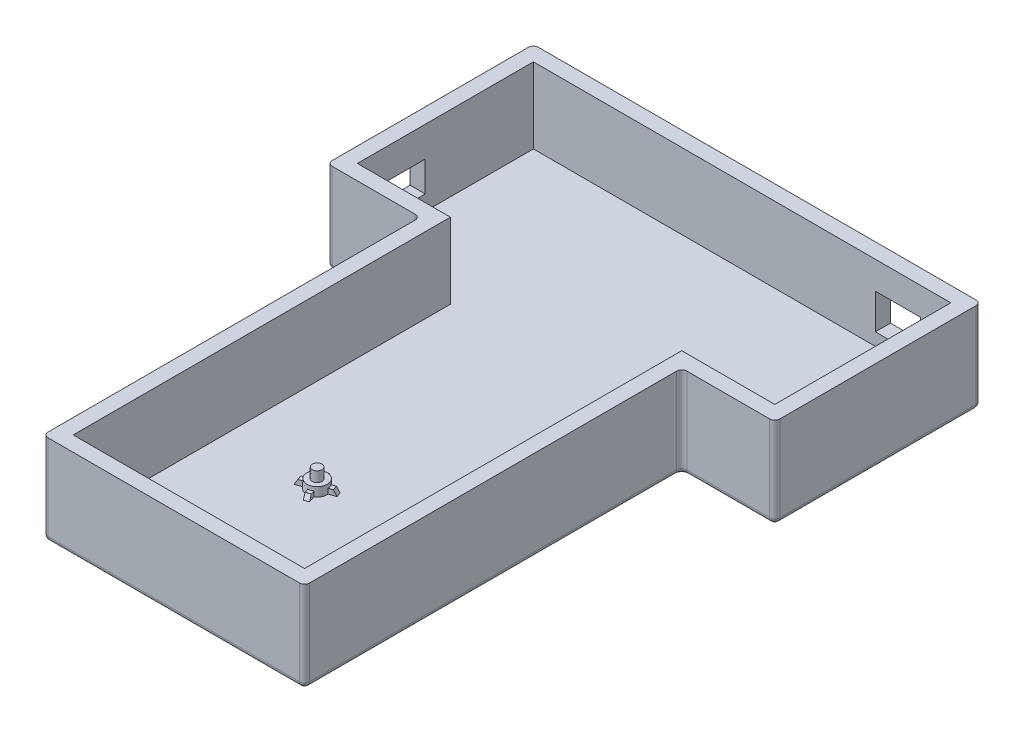
from build123d import *

# Parameters (mm, degrees)
BOSS_EXTRUDE1_DEPTH = 15
SHELL1_T            = 3
SKETCH2_W           = 10.2
SKETCH2_H           = 6
CUT_EXTRUDE1_DEPTH  = 4
SKETCH3_W           = 9
SKETCH3_H           = 7
CUT_EXTRUDE2_DEPTH  = 4
FILLET1_R           = 1


with BuildPart() as part:
    # Sketch1 → Boss-Extrude1 (new body)
    with BuildSketch(Plane(origin=(0, 0, 0), x_dir=(1, 0, 0), z_dir=(0, 1, 0))):
        Polygon((64.5, 0), (18.5, 0), (18.5, 75), (0, 75), (0, 110), (83, 110), (83, 75), (64.5, 75), align=None)
    extrude(amount=BOSS_EXTRUDE1_DEPTH)

    # Shell1
    shell1_openings = [part.faces().sort_by_distance(p)[0] for p in [
        (41.5, 15, -62.641620771),
    ]]
    offset(amount=SHELL1_T, openings=shell1_openings, kind=Kind.INTERSECTION)

    # Sketch2 → Cut-Extrude1 (cut)
    with BuildSketch(Plane.ZY.offset(3)):
        with Locations((-83.4, 6)):
            Rectangle(SKETCH2_W, SKETCH2_H)
    extrude(amount=-CUT_EXTRUDE1_DEPTH, mode=Mode.SUBTRACT)

    # Sketch3 → Cut-Extrude2 (cut)
    with BuildSketch(Plane(origin=(0, 0, -113), x_dir=(-1, 0, 0), z_dir=(0, 0, -1))):
        with Locations((-72.5, 6)):
            Rectangle(SKETCH3_W, SKETCH3_H)
    extrude(amount=-CUT_EXTRUDE2_DEPTH, mode=Mode.SUBTRACT)

    # Mounting Boss1: read off the stored shape, not the designer's step
    # Mounting Boss1 outline → Mounting Boss1 (revolve)
    with BuildSketch(Plane(origin=(37, 0, -30), x_dir=(1, 0, 0), z_dir=(0, 0, 1))):
        Polygon((2, 1.746), (1, 1.746), (0.96508987, 3.746), (0, 3.746), (0, 0), (2.060971664, 0), align=None)
    revolve(axis=Axis((37, 0, -30), (0, 1, 0)))

    # Mounting Boss1 2: loft between two sections, ruled curve by curve
    mounting_boss1_2_from = [
        Edge.make_line((36.406329718, 0, -33.362149675), (36.84207555, 0, -32.05491218)),
        Edge.make_line((35.893392252, 0, -31.738684414), (35.45764642, 0, -33.045921909)),
        Edge.make_line((36.406329718, 0, -33.362149675), (35.45764642, 0, -33.045921909)),
        Edge.make_line((35.893392252, 0, -31.738684414), (36.84207555, 0, -32.05491218)),
    ]
    mounting_boss1_2_to = [
        Edge.make_line((36.572344576, 1, -32.808907341), (36.835525733, 1, -32.01936387)),
        Edge.make_line((35.919961092, 1, -31.714175657), (35.656779935, 1, -32.503719128)),
        Edge.make_line((36.572344576, 1, -32.808907341), (35.656779935, 1, -32.503719128)),
        Edge.make_line((35.919961092, 1, -31.714175657), (36.835525733, 1, -32.01936387)),
    ]
    mounting_boss1_2 = Solid(Shell([*[Face.make_surface_from_curves(mounting_boss1_2_from[k], mounting_boss1_2_to[k]) for k in range(4)], Face(Wire(mounting_boss1_2_from)), Face(Wire(mounting_boss1_2_to))]))
    add(mounting_boss1_2)

    # Mounting Boss1 3: loft between two sections, ruled curve by curve
    mounting_boss1_3_from = [
        Edge.make_line((38.106607748, 0, -28.261315586), (38.54235358, 0, -26.954078091)),
        Edge.make_line((37.593670282, 0, -26.637850325), (37.15792445, 0, -27.94508782)),
        Edge.make_line((37.593670282, 0, -26.637850325), (38.54235358, 0, -26.954078091)),
        Edge.make_line((37.15792445, 0, -27.94508782), (38.106607748, 0, -28.261315586)),
    ]
    mounting_boss1_3_to = [
        Edge.make_line((38.080038908, 1, -28.285824343), (38.343220065, 1, -27.496280872)),
        Edge.make_line((37.427655424, 1, -27.191092659), (37.164474267, 1, -27.98063613)),
        Edge.make_line((37.427655424, 1, -27.191092659), (38.343220065, 1, -27.496280872)),
        Edge.make_line((37.164474267, 1, -27.98063613), (38.080038908, 1, -28.285824343)),
    ]
    mounting_boss1_3 = Solid(Shell([*[Face.make_surface_from_curves(mounting_boss1_3_from[k], mounting_boss1_3_to[k]) for k in range(4)], Face(Wire(mounting_boss1_3_from)), Face(Wire(mounting_boss1_3_to))]))
    add(mounting_boss1_3)

    # Mounting Boss1 4: loft between two sections, ruled curve by curve
    mounting_boss1_4_from = [
        Edge.make_line((40.362149675, 0, -30.593670282), (39.05491218, 0, -30.15792445)),
        Edge.make_line((38.738684414, 0, -31.106607748), (40.045921909, 0, -31.54235358)),
        Edge.make_line((40.362149675, 0, -30.593670282), (40.045921909, 0, -31.54235358)),
        Edge.make_line((38.738684414, 0, -31.106607748), (39.05491218, 0, -30.15792445)),
    ]
    mounting_boss1_4_to = [
        Edge.make_line((39.808907341, 1, -30.427655424), (39.01936387, 1, -30.164474267)),
        Edge.make_line((38.714175657, 1, -31.080038908), (39.503719128, 1, -31.343220065)),
        Edge.make_line((39.808907341, 1, -30.427655424), (39.503719128, 1, -31.343220065)),
        Edge.make_line((38.714175657, 1, -31.080038908), (39.01936387, 1, -30.164474267)),
    ]
    mounting_boss1_4 = Solid(Shell([*[Face.make_surface_from_curves(mounting_boss1_4_from[k], mounting_boss1_4_to[k]) for k in range(4)], Face(Wire(mounting_boss1_4_from)), Face(Wire(mounting_boss1_4_to))]))
    add(mounting_boss1_4)

    # Mounting Boss1 5: loft between two sections, ruled curve by curve
    mounting_boss1_5_from = [
        Edge.make_line((35.261315586, 0, -28.893392252), (33.954078091, 0, -28.45764642)),
        Edge.make_line((33.637850325, 0, -29.406329718), (34.94508782, 0, -29.84207555)),
        Edge.make_line((33.637850325, 0, -29.406329718), (33.954078091, 0, -28.45764642)),
        Edge.make_line((34.94508782, 0, -29.84207555), (35.261315586, 0, -28.893392252)),
    ]
    mounting_boss1_5_to = [
        Edge.make_line((35.285824343, 1, -28.919961092), (34.496280872, 1, -28.656779935)),
        Edge.make_line((34.191092659, 1, -29.572344576), (34.98063613, 1, -29.835525733)),
        Edge.make_line((34.191092659, 1, -29.572344576), (34.496280872, 1, -28.656779935)),
        Edge.make_line((34.98063613, 1, -29.835525733), (35.285824343, 1, -28.919961092)),
    ]
    mounting_boss1_5 = Solid(Shell([*[Face.make_surface_from_curves(mounting_boss1_5_from[k], mounting_boss1_5_to[k]) for k in range(4)], Face(Wire(mounting_boss1_5_from)), Face(Wire(mounting_boss1_5_to))]))
    add(mounting_boss1_5)

    # Mounting Boss3: read off the stored shape, not the designer's step
    # Mounting Boss3 outline → Mounting Boss3 (revolve)
    with BuildSketch(Plane(origin=(77, 0, -82), x_dir=(1, 0, 0), z_dir=(0, 0, 1))):
        Polygon((2, 1.746), (1, 1.746), (0.895184441, 3.746), (0, 3.746), (0, 0), (2.060971664, 0), align=None)
    revolve(axis=Axis((77, 0, -82), (0, 1, 0)))

    # Mounting Boss3 2: loft between two sections, ruled curve by curve
    mounting_boss3_2_from = [
        Edge.make_line((76.406329718, 0, -85.362149675), (76.84207555, 0, -84.05491218)),
        Edge.make_line((75.893392252, 0, -83.738684414), (75.45764642, 0, -85.045921909)),
        Edge.make_line((76.406329718, 0, -85.362149675), (75.45764642, 0, -85.045921909)),
        Edge.make_line((75.893392252, 0, -83.738684414), (76.84207555, 0, -84.05491218)),
    ]
    mounting_boss3_2_to = [
        Edge.make_line((76.572344576, 1, -84.808907341), (76.835525733, 1, -84.01936387)),
        Edge.make_line((75.919961092, 1, -83.714175657), (75.656779935, 1, -84.503719128)),
        Edge.make_line((76.572344576, 1, -84.808907341), (75.656779935, 1, -84.503719128)),
        Edge.make_line((75.919961092, 1, -83.714175657), (76.835525733, 1, -84.01936387)),
    ]
    mounting_boss3_2 = Solid(Shell([*[Face.make_surface_from_curves(mounting_boss3_2_from[k], mounting_boss3_2_to[k]) for k in range(4)], Face(Wire(mounting_boss3_2_from)), Face(Wire(mounting_boss3_2_to))]))
    add(mounting_boss3_2)

    # Mounting Boss3 3: loft between two sections, ruled curve by curve
    mounting_boss3_3_from = [
        Edge.make_line((80.362149675, 0, -82.593670282), (79.05491218, 0, -82.15792445)),
        Edge.make_line((78.738684414, 0, -83.106607748), (80.045921909, 0, -83.54235358)),
        Edge.make_line((80.362149675, 0, -82.593670282), (80.045921909, 0, -83.54235358)),
        Edge.make_line((78.738684414, 0, -83.106607748), (79.05491218, 0, -82.15792445)),
    ]
    mounting_boss3_3_to = [
        Edge.make_line((79.808907341, 1, -82.427655424), (79.01936387, 1, -82.164474267)),
        Edge.make_line((78.714175657, 1, -83.080038908), (79.503719128, 1, -83.343220065)),
        Edge.make_line((79.808907341, 1, -82.427655424), (79.503719128, 1, -83.343220065)),
        Edge.make_line((78.714175657, 1, -83.080038908), (79.01936387, 1, -82.164474267)),
    ]
    mounting_boss3_3 = Solid(Shell([*[Face.make_surface_from_curves(mounting_boss3_3_from[k], mounting_boss3_3_to[k]) for k in range(4)], Face(Wire(mounting_boss3_3_from)), Face(Wire(mounting_boss3_3_to))]))
    add(mounting_boss3_3)

    # Mounting Boss3 4: loft between two sections, ruled curve by curve
    mounting_boss3_4_from = [
        Edge.make_line((78.106607748, 0, -80.261315586), (78.54235358, 0, -78.954078091)),
        Edge.make_line((77.593670282, 0, -78.637850325), (77.15792445, 0, -79.94508782)),
        Edge.make_line((77.593670282, 0, -78.637850325), (78.54235358, 0, -78.954078091)),
        Edge.make_line((77.15792445, 0, -79.94508782), (78.106607748, 0, -80.261315586)),
    ]
    mounting_boss3_4_to = [
        Edge.make_line((78.080038908, 1, -80.285824343), (78.343220065, 1, -79.496280872)),
        Edge.make_line((77.427655424, 1, -79.191092659), (77.164474267, 1, -79.98063613)),
        Edge.make_line((77.427655424, 1, -79.191092659), (78.343220065, 1, -79.496280872)),
        Edge.make_line((77.164474267, 1, -79.98063613), (78.080038908, 1, -80.285824343)),
    ]
    mounting_boss3_4 = Solid(Shell([*[Face.make_surface_from_curves(mounting_boss3_4_from[k], mounting_boss3_4_to[k]) for k in range(4)], Face(Wire(mounting_boss3_4_from)), Face(Wire(mounting_boss3_4_to))]))
    add(mounting_boss3_4)

    # Mounting Boss3 5: loft between two sections, ruled curve by curve
    mounting_boss3_5_from = [
        Edge.make_line((75.261315586, 0, -80.893392252), (73.954078091, 0, -80.45764642)),
        Edge.make_line((73.637850325, 0, -81.406329718), (74.94508782, 0, -81.84207555)),
        Edge.make_line((73.637850325, 0, -81.406329718), (73.954078091, 0, -80.45764642)),
        Edge.make_line((74.94508782, 0, -81.84207555), (75.261315586, 0, -80.893392252)),
    ]
    mounting_boss3_5_to = [
        Edge.make_line((75.285824343, 1, -80.919961092), (74.496280872, 1, -80.656779935)),
        Edge.make_line((74.191092659, 1, -81.572344576), (74.98063613, 1, -81.835525733)),
        Edge.make_line((74.191092659, 1, -81.572344576), (74.496280872, 1, -80.656779935)),
        Edge.make_line((74.98063613, 1, -81.835525733), (75.285824343, 1, -80.919961092)),
    ]
    mounting_boss3_5 = Solid(Shell([*[Face.make_surface_from_curves(mounting_boss3_5_from[k], mounting_boss3_5_to[k]) for k in range(4)], Face(Wire(mounting_boss3_5_from)), Face(Wire(mounting_boss3_5_to))]))
    add(mounting_boss3_5)

    # Fillet1
    fillet1_edges = [part.edges().sort_by_distance(p)[0] for p in [
        (6.25, -3, -72),
        (-3, -3, -92.5),
        (41.5, -3, -113),
        (86, -3, -92.5),
        (76.75, -3, -72),
        (67.5, -3, -34.5),
        (41.5, -3, 3),
        (15.5, 6, 3),
        (15.5, 6, -72),
        (-3, 6, -72),
        (-3, 6, -113),
        (86, 6, -113),
        (86, 6, -72),
        (67.5, 6, -72),
        (67.5, 6, 3),
        (15.5, -3, -34.5),
    ]]
    fillet(fillet1_edges, radius=FILLET1_R)


solid = part.part
